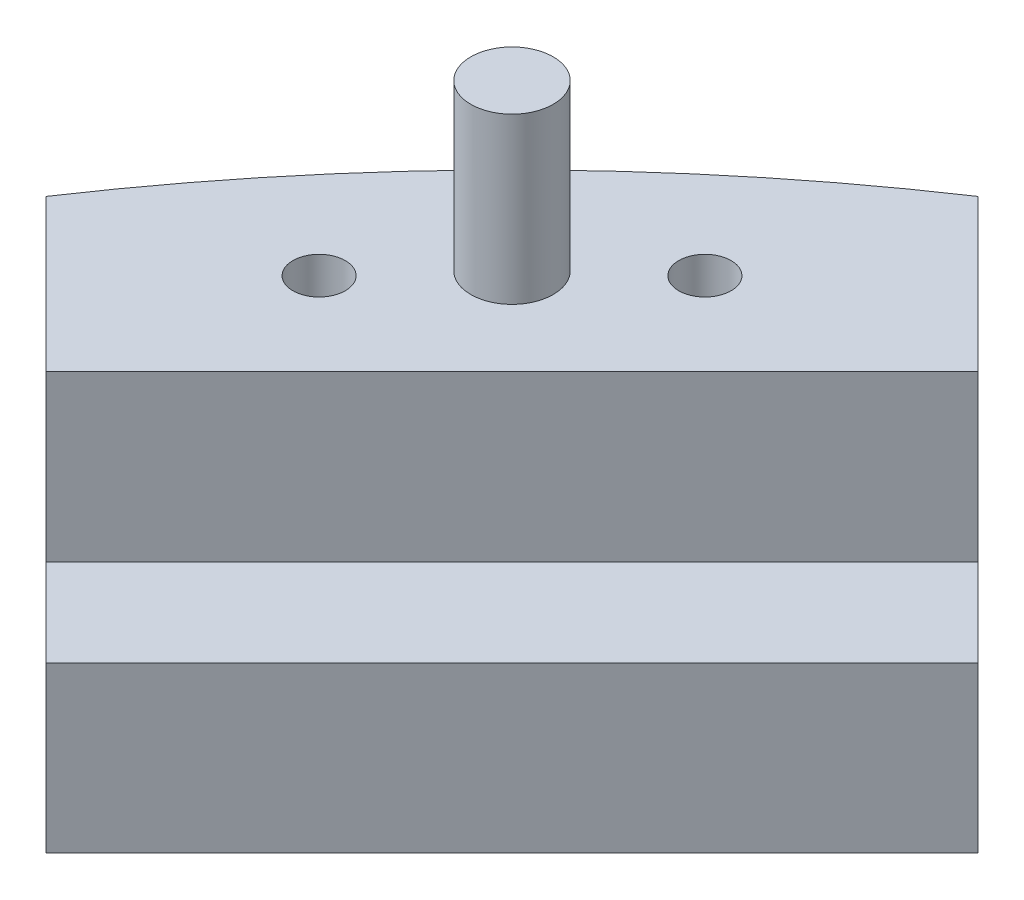
from build123d import *

# Parameters (mm, degrees)
BOSS_EXTRUDE1_DEPTH    = 25.4
CUT_EXTRUDE1_DEPTH     = 136.04018152
F_10_32_TAPPED_HOLE1_D = 4.0386
SKETCH21_R             = 3.175
BOSS_EXTRUDE2_DEPTH    = 12.7
BODY_MOVE_COPY1_ANGLE  = 45


with BuildPart() as part:
    # Sketch1 → Boss-Extrude1 (new, symmetric)
    with BuildSketch(Plane(origin=(0, 0, 0), x_dir=(0, 0, -1), z_dir=(1, 0, 0))):
        Polygon((101.6, 164.337866462), (111.125, 164.337866462), (111.125, 177.037866462), (130.175, 177.037866462), (130.175, 151.637866462), (101.6, 151.637866462), align=None)
    extrude(amount=BOSS_EXTRUDE1_DEPTH, both=True)

    # Sketch23 → Cut-Extrude1 (cut, through all)
    with BuildSketch(Plane(origin=(0, 177.037866462, 0), x_dir=(1, 0, 0), z_dir=(0, 1, 0))):
        with BuildLine():
            Line((-2.8e-08, 130.175), (-25.4, 130.175))
            Line((-25.4, 130.175), (-25.4, 127.672904819))
            ThreePointArc((-25.4, 127.672904819), (-12.761470152, 129.547966038), (-2.8e-08, 130.175))
        make_face()
        with BuildLine():
            Line((25.4, 130.175), (-2.8e-08, 130.175))
            ThreePointArc((-2.8e-08, 130.175), (12.761470124, 129.547966041), (25.4, 127.672904819))
            Line((25.4, 127.672904819), (25.4, 130.175))
        make_face()
    extrude(amount=-CUT_EXTRUDE1_DEPTH, mode=Mode.SUBTRACT)

    # #10-32 Tapped Hole1 (through all)
    with Locations(Plane(origin=(0, 177.037866462, 0), x_dir=(1, 0, 0), z_dir=(0, 1, 0))):
        with Locations((-10.515340363, 120.190890325), (10.515340363, 120.190890325)):
            Hole(F_10_32_TAPPED_HOLE1_D / 2)

    # Sketch21 → Boss-Extrude2 (add)
    with BuildSketch(Plane(origin=(0, 177.037866462, 0), x_dir=(1, 0, 0), z_dir=(0, 1, 0))):
        with Locations((0, 120.65)):
            Circle(SKETCH21_R)
    extrude(amount=BOSS_EXTRUDE2_DEPTH)


with BuildPart() as part_1:
    # Body-Move/Copy1: moved
    add(part.part.rotate(Axis((0, 0, 0), (0, 1, 0)), BODY_MOVE_COPY1_ANGLE))


solid = part_1.part
